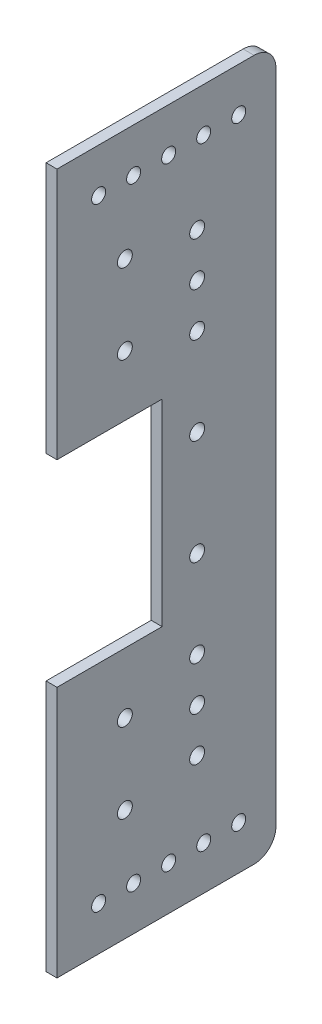
from build123d import *

# Parameters (mm, degrees)
SKETCH_1_W                  = 82
SKETCH_1_H                  = 160
EXTRUDE_1_DEPTH             = 50
SKETCH_2_W                  = 79.5
SKETCH_2_H                  = 47.5
CUT_EXTRUDE_1_DEPTH         = 187.611896727
CUT_EXTRUDE_2_DEPTH         = 186.95765647
CUT_EXTRUDE_3_DEPTH         = 186.95765647
CUT_EXTRUDE_4_DEPTH         = 186.95765647
CUT_EXTRUDE_5_DEPTH         = 186.95765647
CUT_EXTRUDE_6_DEPTH         = 186.95765647
CUT_EXTRUDE_7_DEPTH         = 186.95765647
CUT_EXTRUDE_8_DEPTH         = 186.95765647
CUT_EXTRUDE_9_DEPTH         = 187.611896727
CUT_EXTRUDE_10_DEPTH        = 187.611896727
CUT_EXTRUDE_11_DEPTH        = 187.611896727
CUT_EXTRUDE_12_DEPTH        = 187.611896727
CUT_EXTRUDE_13_DEPTH        = 187.611896727
CUT_EXTRUDE_14_DEPTH        = 187.611896727
CUT_EXTRUDE_15_DEPTH        = 187.611896727
CUT_EXTRUDE_16_DEPTH        = 187.611896727
CUT_EXTRUDE_17_DEPTH        = 187.611896727
CUT_EXTRUDE_18_DEPTH        = 187.611896727
CUT_EXTRUDE_19_DEPTH        = 187.611896727
CUT_EXTRUDE_20_DEPTH        = 187.611896727
HOLE_WIZARD_3_2_3_2_1_D     = 3.2
HOLE_WIZARD_3_2_3_2_1_DEPTH = 50
FILLET_START                = -2.5
FILLET_3_OUTLINE_R          = 1.7
FILLET_3_OUTLINE_R_2        = 2.5
FILLET_3_DEPTH              = 2.5
FILLET_START_2              = 2.9766
FILLET_3_2_OUTLINE_R        = 1.6
FILLET_3_2_DEPTH            = 80.0234
SKETCH_30_W                 = 2.5
SKETCH_30_H                 = 160
CUT_EXTRUDE_21_DEPTH        = 132
SKETCH_32_R                 = 1.7
CUT_EXTRUDE_22_DEPTH        = 10
SKETCH_33_R                 = 1.7
CUT_EXTRUDE_23_DEPTH        = 10
SKETCH_38_W                 = 28.294736035
SKETCH_38_H                 = 5.600607545
SKETCH_38_W_2               = 28.965642147
SKETCH_38_H_2               = 14.371074317
SKETCH_38_W_3               = 26.69564561
SKETCH_38_H_3               = 6.403188365
SKETCH_38_W_4               = 27.042946808
SKETCH_38_H_4               = 4.713568993
SKETCH_38_W_5               = 27.218337555
SKETCH_38_H_5               = 14.471497388
SKETCH_38_W_6               = 27.711201197
SKETCH_38_H_6               = 6.014834368
SKETCH_38_W_7               = 34.73726222
SKETCH_38_H_7               = 47.004617059
EXTRUDE_2_DEPTH             = 2.5
SKETCH_39_R                 = 1.7
CUT_EXTRUDE_24_DEPTH        = 10
SKETCH_40_R                 = 1.7
CUT_EXTRUDE_25_DEPTH        = 10
SKETCH_41_R                 = 1.7
CUT_EXTRUDE_26_DEPTH        = 10
SKETCH_42_R                 = 1.7
CUT_EXTRUDE_27_DEPTH        = 10
CUT_EXTRUDE_30_DEPTH        = 168.649187293


with BuildPart() as part:
    # 草图1 → 凸台-拉伸1 (new body)
    with BuildSketch(Plane(origin=(0, 0, -50), x_dir=(-1, 0, 0), z_dir=(0, 0, -1))):
        with Locations((-41, 80)):
            Rectangle(SKETCH_1_W, SKETCH_1_H)
    extrude(amount=-EXTRUDE_1_DEPTH)

    # 草图2 → 切除-拉伸1 (cut, through all)
    with BuildSketch(Plane(origin=(0, 160, 0), x_dir=(-1, 0, 0), z_dir=(0, 1, 0))):
        with Locations((-39.75, -26.25)):
            Rectangle(SKETCH_2_W, SKETCH_2_H)
    extrude(amount=-CUT_EXTRUDE_1_DEPTH, mode=Mode.SUBTRACT)

    # 草图3 → 切除-拉伸2 (cut, through all)
    with BuildSketch(Plane(origin=(0, 0, -2.5), x_dir=(-1, 0, 0), z_dir=(0, 0, -1))):
        with BuildLine():
            Line((-65, 89.5), (-20, 89.5))
            ThreePointArc((-20, 89.5), (-17.5, 92), (-20, 94.5))
            Line((-20, 94.5), (-65, 94.5))
            ThreePointArc((-65, 94.5), (-67.5, 92), (-65, 89.5))
        make_face()
    extrude(amount=-CUT_EXTRUDE_2_DEPTH, mode=Mode.SUBTRACT)

    # 草图4 → 切除-拉伸3 (cut, through all)
    with BuildSketch(Plane(origin=(0, 0, -2.5), x_dir=(-1, 0, 0), z_dir=(0, 0, -1))):
        with BuildLine():
            Line((-68, 35), (-38, 35))
            ThreePointArc((-38, 35), (-36.4, 36.6), (-38, 38.2))
            Line((-38, 38.2), (-68, 38.2))
            ThreePointArc((-68, 38.2), (-69.6, 36.6), (-68, 35))
        make_face()
    extrude(amount=-CUT_EXTRUDE_3_DEPTH, mode=Mode.SUBTRACT)

    # 草图5 → 切除-拉伸4 (cut, through all)
    with BuildSketch(Plane(origin=(0, 0, -2.5), x_dir=(-1, 0, 0), z_dir=(0, 0, -1))):
        with BuildLine():
            Line((-65, 65.5), (-20, 65.5))
            ThreePointArc((-20, 65.5), (-17.5, 68), (-20, 70.5))
            Line((-20, 70.5), (-65, 70.5))
            ThreePointArc((-65, 70.5), (-67.5, 68), (-65, 65.5))
        make_face()
    extrude(amount=-CUT_EXTRUDE_4_DEPTH, mode=Mode.SUBTRACT)

    # 草图6 → 切除-拉伸5 (cut, through all)
    with BuildSketch(Plane(origin=(0, 0, -2.5), x_dir=(-1, 0, 0), z_dir=(0, 0, -1))):
        with BuildLine():
            Line((-68, 50), (-38, 50))
            ThreePointArc((-38, 50), (-36.4, 51.6), (-38, 53.2))
            Line((-38, 53.2), (-68, 53.2))
            ThreePointArc((-68, 53.2), (-69.6, 51.6), (-68, 50))
        make_face()
    extrude(amount=-CUT_EXTRUDE_5_DEPTH, mode=Mode.SUBTRACT)

    # 草图7 → 切除-拉伸6 (cut, through all)
    with BuildSketch(Plane(origin=(0, 0, -2.5), x_dir=(-1, 0, 0), z_dir=(0, 0, -1))):
        with BuildLine():
            Line((-68, 20), (-38, 20))
            ThreePointArc((-38, 20), (-36.4, 21.6), (-38, 23.2))
            Line((-38, 23.2), (-68, 23.2))
            ThreePointArc((-68, 23.2), (-69.6, 21.6), (-68, 20))
        make_face()
    extrude(amount=-CUT_EXTRUDE_6_DEPTH, mode=Mode.SUBTRACT)

    # 草图8 → 切除-拉伸7 (cut, through all)
    with BuildSketch(Plane(origin=(0, 0, -2.5), x_dir=(-1, 0, 0), z_dir=(0, 0, -1))):
        with BuildLine():
            Line((-68, 106.8), (-38, 106.8))
            ThreePointArc((-38, 106.8), (-36.4, 108.4), (-38, 110))
            Line((-38, 110), (-68, 110))
            ThreePointArc((-68, 110), (-69.6, 108.4), (-68, 106.8))
        make_face()
    extrude(amount=-CUT_EXTRUDE_7_DEPTH, mode=Mode.SUBTRACT)

    # 草图9 → 切除-拉伸8 (cut, through all)
    with BuildSketch(Plane(origin=(0, 0, -2.5), x_dir=(-1, 0, 0), z_dir=(0, 0, -1))):
        with BuildLine():
            Line((-68, 121.8), (-38, 121.8))
            ThreePointArc((-38, 121.8), (-36.4, 123.4), (-38, 125))
            Line((-38, 125), (-68, 125))
            ThreePointArc((-68, 125), (-69.6, 123.4), (-68, 121.8))
        make_face()
    extrude(amount=-CUT_EXTRUDE_8_DEPTH, mode=Mode.SUBTRACT)

    # 草图10 → 切除-拉伸9 (cut, through all)
    with BuildSketch(Plane(origin=(82, 0, 0), x_dir=(0, 0, -1), z_dir=(1, 0, 0))):
        with BuildLine():
            Line((20.690598923, 80), (16.690598923, 86.92820323))
            ThreePointArc((16.690598923, 86.92820323), (13.629378785, 80), (16.690598923, 73.07179677))
            Line((16.690598923, 73.07179677), (20.690598923, 80))
        make_face()
    extrude(amount=-CUT_EXTRUDE_9_DEPTH, mode=Mode.SUBTRACT)

    # 草图11 → 切除-拉伸10 (cut, through all)
    with BuildSketch(Plane(origin=(82, 0, 0), x_dir=(0, 0, -1), z_dir=(1, 0, 0))):
        with BuildLine():
            Line((20.154700538, 88.92820323), (24.154700538, 82))
            Line((24.154700538, 82), (32.154700538, 82))
            ThreePointArc((32.154700538, 82), (27.685310607, 88.115196021), (20.154700538, 88.92820323))
        make_face()
    extrude(amount=-CUT_EXTRUDE_10_DEPTH, mode=Mode.SUBTRACT)

    # 草图12 → 切除-拉伸11 (cut, through all)
    with BuildSketch(Plane(origin=(82, 0, 0), x_dir=(0, 0, -1), z_dir=(1, 0, 0))):
        with BuildLine():
            Line((24.154700538, 78), (20.154700538, 71.07179677))
            ThreePointArc((20.154700538, 71.07179677), (27.685310607, 71.884803979), (32.154700538, 78))
            Line((32.154700538, 78), (24.154700538, 78))
        make_face()
    extrude(amount=-CUT_EXTRUDE_11_DEPTH, mode=Mode.SUBTRACT)

    # 草图13 → 切除-拉伸12 (cut, through all)
    with BuildSketch(Plane(origin=(82, 0, 0), x_dir=(0, 0, -1), z_dir=(1, 0, 0))):
        with BuildLine():
            Line((36, 21.2), (14, 21.2))
            ThreePointArc((14, 21.2), (12.4, 19.6), (14, 18))
            Line((14, 18), (36, 18))
            ThreePointArc((36, 18), (37.6, 19.6), (36, 21.2))
        make_face()
    extrude(amount=-CUT_EXTRUDE_12_DEPTH, mode=Mode.SUBTRACT)

    # 草图14 → 切除-拉伸13 (cut, through all)
    with BuildSketch(Plane(origin=(82, 0, 0), x_dir=(0, 0, -1), z_dir=(1, 0, 0))):
        with BuildLine():
            Line((36, 31.2), (14, 31.2))
            ThreePointArc((14, 31.2), (12.4, 29.6), (14, 28))
            Line((14, 28), (36, 28))
            ThreePointArc((36, 28), (37.6, 29.6), (36, 31.2))
        make_face()
    extrude(amount=-CUT_EXTRUDE_13_DEPTH, mode=Mode.SUBTRACT)

    # 草图15 → 切除-拉伸14 (cut, through all)
    with BuildSketch(Plane(origin=(82, 0, 0), x_dir=(0, 0, -1), z_dir=(1, 0, 0))):
        with BuildLine():
            Line((36, 41.2), (14, 41.2))
            ThreePointArc((14, 41.2), (12.4, 39.6), (14, 38))
            Line((14, 38), (36, 38))
            ThreePointArc((36, 38), (37.6, 39.6), (36, 41.2))
        make_face()
    extrude(amount=-CUT_EXTRUDE_14_DEPTH, mode=Mode.SUBTRACT)

    # 草图16 → 切除-拉伸15 (cut, through all)
    with BuildSketch(Plane(origin=(82, 0, 0), x_dir=(0, 0, -1), z_dir=(1, 0, 0))):
        with BuildLine():
            Line((36, 51.2), (14, 51.2))
            ThreePointArc((14, 51.2), (12.4, 49.6), (14, 48))
            Line((14, 48), (36, 48))
            ThreePointArc((36, 48), (37.6, 49.6), (36, 51.2))
        make_face()
    extrude(amount=-CUT_EXTRUDE_15_DEPTH, mode=Mode.SUBTRACT)

    # 草图17 → 切除-拉伸16 (cut, through all)
    with BuildSketch(Plane(origin=(82, 0, 0), x_dir=(0, 0, -1), z_dir=(1, 0, 0))):
        with BuildLine():
            Line((36, 112), (14, 112))
            ThreePointArc((14, 112), (12.4, 110.4), (14, 108.8))
            Line((14, 108.8), (36, 108.8))
            ThreePointArc((36, 108.8), (37.6, 110.4), (36, 112))
        make_face()
    extrude(amount=-CUT_EXTRUDE_16_DEPTH, mode=Mode.SUBTRACT)

    # 草图18 → 切除-拉伸17 (cut, through all)
    with BuildSketch(Plane(origin=(82, 0, 0), x_dir=(0, 0, -1), z_dir=(1, 0, 0))):
        with BuildLine():
            Line((36, 122), (14, 122))
            ThreePointArc((14, 122), (12.4, 120.4), (14, 118.8))
            Line((14, 118.8), (36, 118.8))
            ThreePointArc((36, 118.8), (37.6, 120.4), (36, 122))
        make_face()
    extrude(amount=-CUT_EXTRUDE_17_DEPTH, mode=Mode.SUBTRACT)

    # 草图19 → 切除-拉伸18 (cut, through all)
    with BuildSketch(Plane(origin=(82, 0, 0), x_dir=(0, 0, -1), z_dir=(1, 0, 0))):
        with BuildLine():
            Line((36, 132), (14, 132))
            ThreePointArc((14, 132), (12.4, 130.4), (14, 128.8))
            Line((14, 128.8), (36, 128.8))
            ThreePointArc((36, 128.8), (37.6, 130.4), (36, 132))
        make_face()
    extrude(amount=-CUT_EXTRUDE_18_DEPTH, mode=Mode.SUBTRACT)

    # 草图20 → 切除-拉伸19 (cut, through all)
    with BuildSketch(Plane(origin=(82, 0, 0), x_dir=(0, 0, -1), z_dir=(1, 0, 0))):
        with BuildLine():
            Line((36, 142), (14, 142))
            ThreePointArc((14, 142), (12.4, 140.4), (14, 138.8))
            Line((14, 138.8), (36, 138.8))
            ThreePointArc((36, 138.8), (37.6, 140.4), (36, 142))
        make_face()
    extrude(amount=-CUT_EXTRUDE_19_DEPTH, mode=Mode.SUBTRACT)

    # 草图21 → 切除-拉伸20 (cut, through all)
    with BuildSketch(Plane.XY):
        with BuildLine():
            Line((68, 140), (38, 140))
            ThreePointArc((38, 140), (36.4, 138.4), (38, 136.8))
            Line((38, 136.8), (68, 136.8))
            ThreePointArc((68, 136.8), (69.6, 138.4), (68, 140))
        make_face()
    extrude(amount=-CUT_EXTRUDE_20_DEPTH, mode=Mode.SUBTRACT)

    # Ø3.2 (3.2) 直径孔1
    with Locations(Plane.XY):
        with Locations((30, 32.75), (30, 38.75), (30, 50)):
            Hole(HOLE_WIZARD_3_2_3_2_1_D / 2, depth=HOLE_WIZARD_3_2_3_2_1_DEPTH)

    # 圆角3: read off the stored shape, not the designer's step
    # 圆角3 outline → 圆角3 (cut)
    with BuildSketch(Plane.XY.offset(FILLET_START)):
        with Locations((22, 35.75)):
            Circle(FILLET_3_OUTLINE_R)
        with Locations((22, 124.25)):
            Circle(FILLET_3_OUTLINE_R)
        with Locations((19, 152)):
            Circle(FILLET_3_OUTLINE_R)
        with Locations((12, 107)):
            Circle(FILLET_3_OUTLINE_R)
        with Locations((12, 53)):
            Circle(FILLET_3_OUTLINE_R)
        with Locations((19, 145)):
            Circle(FILLET_3_OUTLINE_R)
        with Locations((19, 15)):
            Circle(FILLET_3_OUTLINE_R)
        with Locations((19, 8)):
            Circle(FILLET_3_OUTLINE_R)
        with Locations((30, 110)):
            Circle(FILLET_3_OUTLINE_R)
        with Locations((30, 127.25)):
            Circle(FILLET_3_OUTLINE_R)
        with Locations((30, 121.25)):
            Circle(FILLET_3_OUTLINE_R)
        with Locations((30, 6)):
            Circle(FILLET_3_OUTLINE_R)
        with Locations((40.5, 6)):
            Circle(FILLET_3_OUTLINE_R)
        with Locations((69.5, 6)):
            Circle(FILLET_3_OUTLINE_R)
        with Locations((69.5, 154)):
            Circle(FILLET_3_OUTLINE_R)
        with Locations((40.5, 154)):
            Circle(FILLET_3_OUTLINE_R)
        with Locations((30, 154)):
            Circle(FILLET_3_OUTLINE_R)
        with Locations((6, 143)):
            Circle(FILLET_3_OUTLINE_R_2)
        with Locations((6, 118)):
            Circle(FILLET_3_OUTLINE_R_2)
        with Locations((6, 42)):
            Circle(FILLET_3_OUTLINE_R_2)
        with Locations((6, 17)):
            Circle(FILLET_3_OUTLINE_R_2)
        with BuildLine():
            Line((0, 160), (0, 155))
            ThreePointArc((0, 155), (1.464466094, 158.535533906), (5, 160))
            Line((5, 160), (0, 160))
        make_face()
        with BuildLine():
            ThreePointArc((5, 0), (1.464466094, 1.464466094), (0, 5))
            Line((0, 5), (0, 0))
            Line((0, 0), (5, 0))
        make_face()
    extrude(amount=FILLET_3_DEPTH, mode=Mode.SUBTRACT)

    # Fillet 3 2 outline → Fillet 3 2 (cut)
    with BuildSketch(Plane.YZ.offset(FILLET_START_2)):
        with Locations((70, -10.5)):
            Circle(FILLET_3_2_OUTLINE_R)
        with Locations((60, -23)):
            Circle(FILLET_3_2_OUTLINE_R)
        with Locations((70, -35.5)):
            Circle(FILLET_3_2_OUTLINE_R)
        with Locations((10, -9.5)):
            Circle(FILLET_3_2_OUTLINE_R)
        with Locations((90, -35.5)):
            Circle(FILLET_3_2_OUTLINE_R)
        with Locations((100, -23)):
            Circle(FILLET_3_2_OUTLINE_R)
        with Locations((90, -10.5)):
            Circle(FILLET_3_2_OUTLINE_R)
        with Locations((10, -17.5)):
            Circle(FILLET_3_2_OUTLINE_R)
        with Locations((10, -25.5)):
            Circle(FILLET_3_2_OUTLINE_R)
        with Locations((10, -33.5)):
            Circle(FILLET_3_2_OUTLINE_R)
        with Locations((10, -41.5)):
            Circle(FILLET_3_2_OUTLINE_R)
        with Locations((150, -41.5)):
            Circle(FILLET_3_2_OUTLINE_R)
        with Locations((150, -33.5)):
            Circle(FILLET_3_2_OUTLINE_R)
        with Locations((150, -25.5)):
            Circle(FILLET_3_2_OUTLINE_R)
        with Locations((150, -17.5)):
            Circle(FILLET_3_2_OUTLINE_R)
        with Locations((150, -9.5)):
            Circle(FILLET_3_2_OUTLINE_R)
        with BuildLine():
            ThreePointArc((160, -45), (158.535533906, -48.535533906), (155, -50))
            Line((155, -50), (160, -50))
            Line((160, -50), (160, -45))
        make_face()
        with BuildLine():
            Line((0, -50), (5, -50))
            ThreePointArc((5, -50), (1.464466094, -48.535533906), (0, -45))
            Line((0, -45), (0, -50))
        make_face()
    extrude(amount=FILLET_3_2_DEPTH, mode=Mode.SUBTRACT)

    # 草图30 → 切除-拉伸21 (cut)
    with BuildSketch(Plane.ZY.offset(-79.5)):
        with Locations((-1.25, 80)):
            Rectangle(SKETCH_30_W, SKETCH_30_H)
    extrude(amount=CUT_EXTRUDE_21_DEPTH, mode=Mode.SUBTRACT)

    # 草图32 → 切除-拉伸22 (cut)
    with BuildSketch(Plane.ZY.offset(-79.5)):
        with Locations((-15.5, 134.5)):
            Circle(SKETCH_32_R)
        with Locations((-15.5, 116.3)):
            Circle(SKETCH_32_R)
    extrude(amount=-CUT_EXTRUDE_22_DEPTH, mode=Mode.SUBTRACT)

    # 草图33 → 切除-拉伸23 (cut)
    with BuildSketch(Plane.ZY.offset(-79.5)):
        with Locations((-15.5, 43.7)):
            Circle(SKETCH_33_R)
        with Locations((-15.5, 25.5)):
            Circle(SKETCH_33_R)
    extrude(amount=-CUT_EXTRUDE_23_DEPTH, mode=Mode.SUBTRACT)

    # 草图38 → 凸台-拉伸2 (add)
    with BuildSketch(Plane.ZY.offset(-79.5)):
        with Locations((-25.367467029, 19.271158986)):
            Rectangle(SKETCH_38_W, SKETCH_38_H)
        with Locations((-25.702920085, 34.599521655)):
            Rectangle(SKETCH_38_W_2, SKETCH_38_H_2)
        with Locations((-25.457756412, 49.837946763)):
            Rectangle(SKETCH_38_W_3, SKETCH_38_H_3)
        with Locations((-24.90231743, 110.852030788)):
            Rectangle(SKETCH_38_W_4, SKETCH_38_H_4)
        with Locations((-24.990012804, 125.469998974)):
            Rectangle(SKETCH_38_W_5, SKETCH_38_H_5)
        with Locations((-25.410909742, 140.718956691)):
            Rectangle(SKETCH_38_W_6, SKETCH_38_H_6)
        with Locations((-23.06745835, 79.778951016)):
            Rectangle(SKETCH_38_W_7, SKETCH_38_H_7)
    extrude(amount=-EXTRUDE_2_DEPTH)

    # 草图39 → 切除-拉伸24 (cut)
    with BuildSketch(Plane.ZY.offset(-79.5)):
        with Locations((-32, 132)):
            Circle(SKETCH_39_R)
        with Locations((-32, 112)):
            Circle(SKETCH_39_R)
    extrude(amount=-CUT_EXTRUDE_24_DEPTH, mode=Mode.SUBTRACT)

    # 草图40 → 切除-拉伸25 (cut)
    with BuildSketch(Plane.ZY.offset(-79.5)):
        with Locations((-32, 28)):
            Circle(SKETCH_40_R)
        with Locations((-32, 48)):
            Circle(SKETCH_40_R)
    extrude(amount=-CUT_EXTRUDE_25_DEPTH, mode=Mode.SUBTRACT)

    # 草图41 → 切除-拉伸26 (cut)
    with BuildSketch(Plane.ZY.offset(-79.5)):
        with Locations((-32, 122)):
            Circle(SKETCH_41_R)
        with Locations((-32, 92)):
            Circle(SKETCH_41_R)
    extrude(amount=-CUT_EXTRUDE_26_DEPTH, mode=Mode.SUBTRACT)

    # 草图42 → 切除-拉伸27 (cut)
    with BuildSketch(Plane.ZY.offset(-79.5)):
        with Locations((-32, 38)):
            Circle(SKETCH_42_R)
        with Locations((-32, 68)):
            Circle(SKETCH_42_R)
    extrude(amount=-CUT_EXTRUDE_27_DEPTH, mode=Mode.SUBTRACT)

    # 草图44 → 切除-拉伸30 (cut, through all)
    with BuildSketch(Plane(origin=(82, 0, 0), x_dir=(0, 0, -1), z_dir=(1, 0, 0))):
        Polygon((0, 80), (0, 102.5), (24, 102.5), (24, 57.5), (0, 57.5), align=None)
    extrude(amount=-CUT_EXTRUDE_30_DEPTH, mode=Mode.SUBTRACT)


solid = part.part
